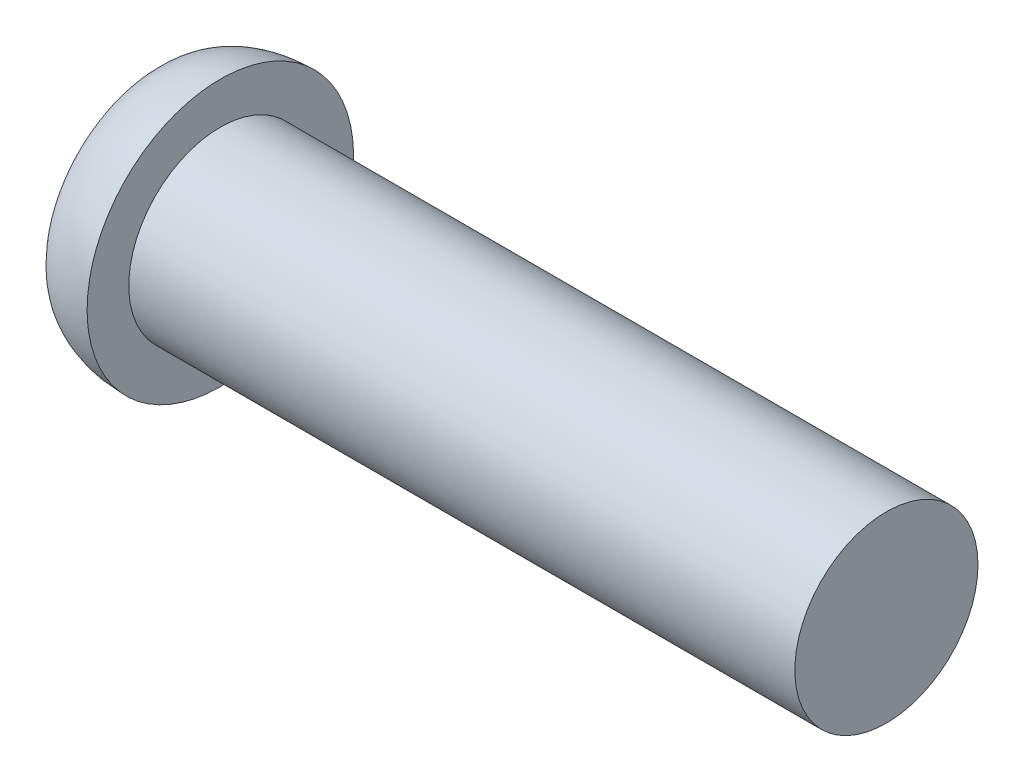
from build123d import *

# Parameters (mm, degrees)
SKETCH1_R           = 2.75
BOSS_EXTRUDE1_DEPTH = 20
SKETCH2_R           = 4
BOSS_EXTRUDE2_DEPTH = 2
FILLET1_SIZE        = 2
FILLET1_SIZE_2      = 1


with BuildPart() as part:
    # Sketch1 → Boss-Extrude1 (new body)
    with BuildSketch(Plane(origin=(0, 0, 0), x_dir=(0, 0, -1), z_dir=(1, 0, 0))):
        Circle(SKETCH1_R)
    extrude(amount=BOSS_EXTRUDE1_DEPTH)

    # Sketch2 → Boss-Extrude2 (add)
    with BuildSketch(Plane.ZY):
        Circle(SKETCH2_R)
    extrude(amount=BOSS_EXTRUDE2_DEPTH)

    # Fillet1
    # an asymmetric fillet: 2, 1 mm, written as the material it takes off along each edge
    with BuildSketch(Plane(origin=(-2, 0, 0), x_dir=(0, 0, 1), z_dir=(0, -1, 0))) as fillet1_piece_1:
        with BuildLine():
            Bezier((4, -FILLET1_SIZE), (4, 0), (4 - FILLET1_SIZE_2, 0), weights=[1, 0.707106781, 1])
            Line((4 - FILLET1_SIZE_2, 0), (4, 0))
            Line((4, 0), (4, -FILLET1_SIZE))
        make_face()
    revolve(axis=Axis((-2, 0, 0), (-1, 0, 0)), mode=Mode.SUBTRACT)


solid = part.part
